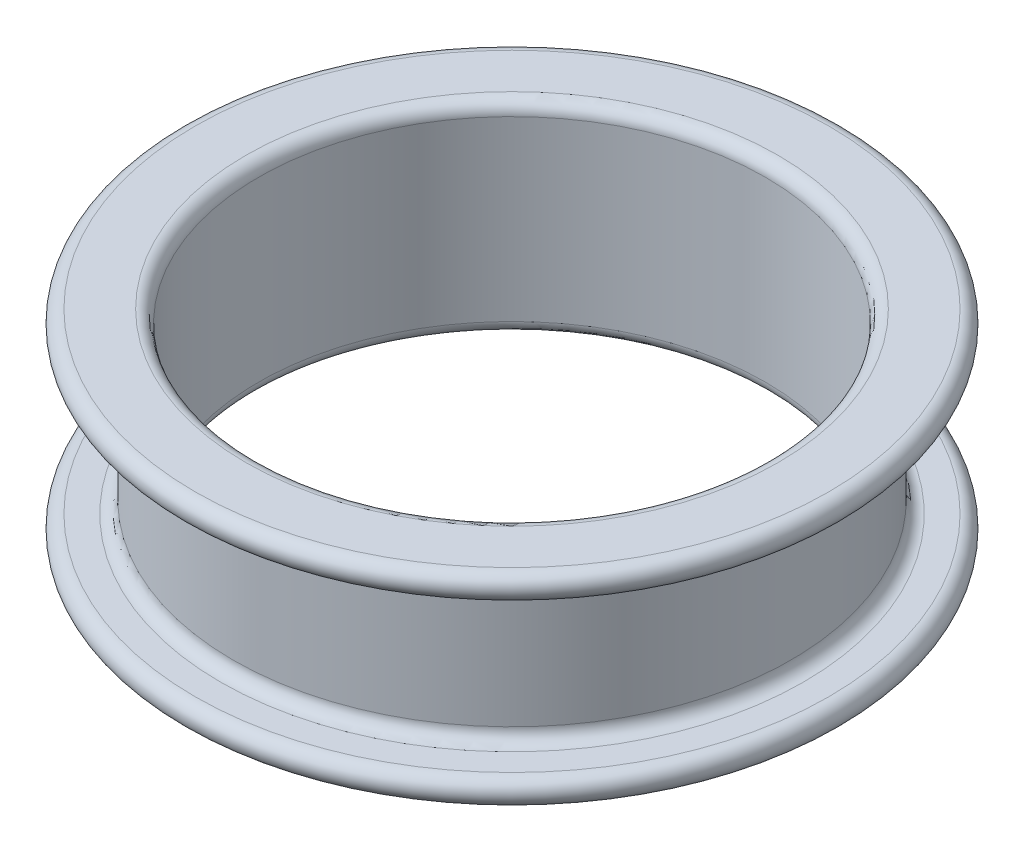
from build123d import *

# Parameters (mm, degrees)
FILLET1_R = 0.5
FILLET2_R = 0.5
FILLET3_R = 0.5


with BuildPart() as part:
    # Sketch2 → Revolve1 (revolve)
    with BuildSketch(Plane.YZ, mode=Mode.PRIVATE) as revolve1_sk:
        Polygon((-4, 10), (-4, 13), (-3, 13), (-3, 11), (3, 11), (3, 13), (4, 13), (4, 10), align=None)
    revolve(revolve1_sk.sketch.rotate(Axis((0, -17.275669785, 0), (0, 1, 0)), 180), axis=Axis((0, -17.275669785, 0), (0, 1, 0)))

    # Fillet1
    fillet1_edges = [part.edges().sort_by_distance(p)[0] for p in [
        (0, -4, 10),
        (0, 4, 10),
        (0, 3, 11),
        (0, -3, 11),
    ]]
    fillet(fillet1_edges, radius=FILLET1_R)

    # Fillet2
    fillet2_edges = [part.edges().sort_by_distance(p)[0] for p in [
        (0, 4, 13),
        (0, 3, 13),
    ]]
    fillet(fillet2_edges, radius=FILLET2_R - 0.0001)  # a hair under: the kernel refuses the full size

    # Fillet3
    fillet3_edges = [part.edges().sort_by_distance(p)[0] for p in [
        (0, -3, 13),
        (0, -4, 13),
    ]]
    fillet(fillet3_edges, radius=FILLET3_R - 0.0001)  # a hair under: the kernel refuses the full size


solid = part.part
